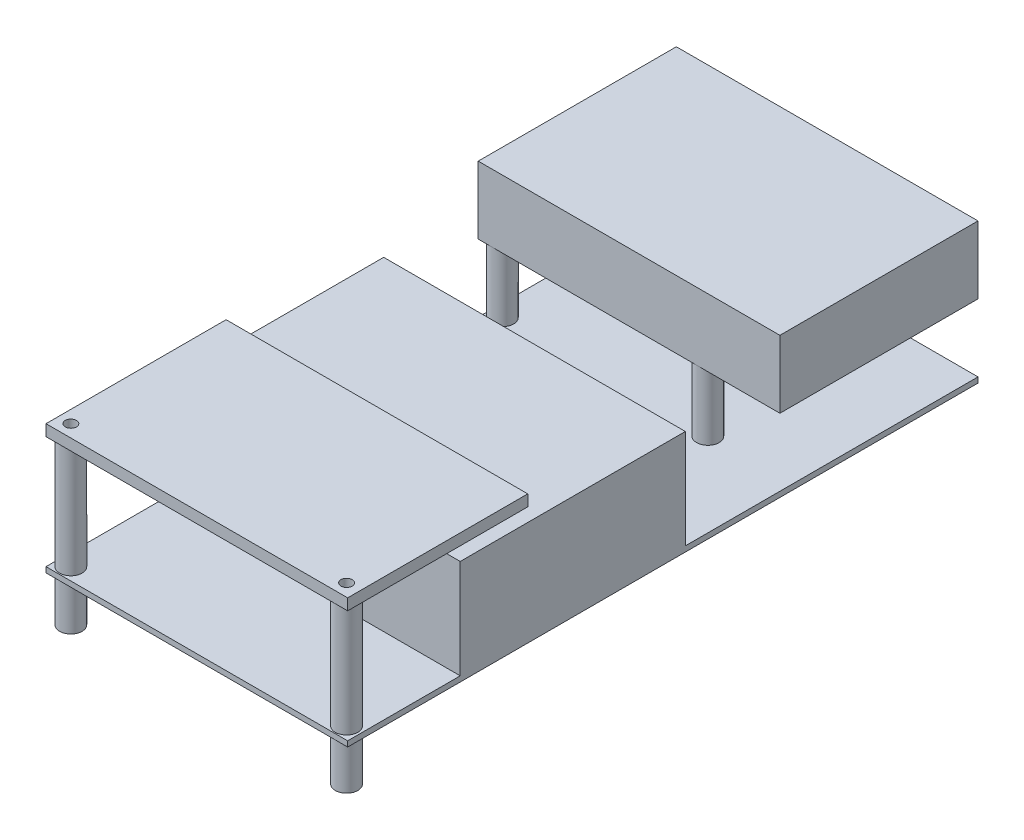
from build123d import *

# Parameters (mm, degrees)
SKETCH1_W           = 85.09
SKETCH1_H           = 177.8
BOSS_EXTRUDE1_DEPTH = 1.524
SKETCH2_R           = 1.5875
CUT_EXTRUDE1_DEPTH  = 198.117910592
SKETCH3_W           = 85.09
SKETCH3_H           = 63.5
BOSS_EXTRUDE2_DEPTH = 27.94
SKETCH4_R           = 3.175
BOSS_EXTRUDE3_DEPTH = 19.05
SKETCH5_W           = 85.09
SKETCH5_H           = 55.88
BOSS_EXTRUDE4_DEPTH = 19.05
BOSS_EXTRUDE5_START = 12.7
SKETCH6_R           = 3.175
BOSS_EXTRUDE5_DEPTH = 12.7
SKETCH7_R           = 3.175
BOSS_EXTRUDE6_DEPTH = 31.75
BOSS_EXTRUDE7_START = 3.175
SKETCH8_W           = 85.09
SKETCH8_H           = 50.8
SKETCH8_R           = 1.5875
BOSS_EXTRUDE7_DEPTH = 3.175


with BuildPart() as part:
    # Sketch1 → Boss-Extrude1 (new body)
    with BuildSketch(Plane(origin=(0, 0, 0), x_dir=(1, 0, 0), z_dir=(0, 1, 0))):
        with Locations((42.545, 88.9)):
            Rectangle(SKETCH1_W, SKETCH1_H)
    extrude(amount=BOSS_EXTRUDE1_DEPTH)

    # Sketch2 → Cut-Extrude1 (cut, through all)
    with BuildSketch(Plane(origin=(0, 1.524, 0), x_dir=(1, 0, 0), z_dir=(0, 1, 0))):
        with Locations((3.5052, 3.5052)):
            Circle(SKETCH2_R)
        with Locations((81.28, 3.5052)):
            Circle(SKETCH2_R)
        with Locations((3.5052, 174.244)):
            Circle(SKETCH2_R)
        with Locations((3.5052, 125.222)):
            Circle(SKETCH2_R)
        with Locations((61.468, 125.222)):
            Circle(SKETCH2_R)
        with Locations((61.468, 174.244)):
            Circle(SKETCH2_R)
    extrude(amount=-CUT_EXTRUDE1_DEPTH, mode=Mode.SUBTRACT)

    # Sketch3 → Boss-Extrude2 (add)
    with BuildSketch(Plane(origin=(0, 1.524, 0), x_dir=(1, 0, 0), z_dir=(0, 1, 0))):
        with Locations((42.545, 63.5)):
            Rectangle(SKETCH3_W, SKETCH3_H)
    extrude(amount=BOSS_EXTRUDE2_DEPTH)

    # Sketch4 → Boss-Extrude3 (add)
    with BuildSketch(Plane(origin=(0, 1.524, 0), x_dir=(1, 0, 0), z_dir=(0, 1, 0))):
        with Locations((3.5052, 174.244)):
            Circle(SKETCH4_R)
        with Locations((61.468, 174.244)):
            Circle(SKETCH4_R)
        with Locations((3.5052, 125.222)):
            Circle(SKETCH4_R)
        with Locations((61.468, 125.222)):
            Circle(SKETCH4_R)
    extrude(amount=BOSS_EXTRUDE3_DEPTH)

    # Sketch5 → Boss-Extrude4 (add)
    with BuildSketch(Plane(origin=(0, 20.574, 0), x_dir=(1, 0, 0), z_dir=(0, 1, 0))):
        with Locations((42.545, 149.86)):
            Rectangle(SKETCH5_W, SKETCH5_H)
    extrude(amount=BOSS_EXTRUDE4_DEPTH)

    # Sketch6 → Boss-Extrude5 (add)
    with BuildSketch(Plane.XZ.offset(BOSS_EXTRUDE5_START)):
        with Locations((3.5052, -3.5052)):
            Circle(SKETCH6_R)
        with Locations((81.28, -3.5052)):
            Circle(SKETCH6_R)
        with Locations((61.468, -125.222)):
            Circle(SKETCH6_R)
        with Locations((3.5052, -125.222)):
            Circle(SKETCH6_R)
        with Locations((3.5052, -174.244)):
            Circle(SKETCH6_R)
        with Locations((61.468, -174.244)):
            Circle(SKETCH6_R)
    extrude(amount=-BOSS_EXTRUDE5_DEPTH)

    # Sketch7 → Boss-Extrude6 (add)
    with BuildSketch(Plane(origin=(0, 1.524, 0), x_dir=(1, 0, 0), z_dir=(0, 1, 0))):
        with Locations((3.5052, 3.5052)):
            Circle(SKETCH7_R)
        with Locations((81.28, 3.5052)):
            Circle(SKETCH7_R)
    extrude(amount=BOSS_EXTRUDE6_DEPTH)

    # Sketch8 → Boss-Extrude7 (add)
    with BuildSketch(Plane(origin=(0, 33.274, 0), x_dir=(1, 0, 0), z_dir=(0, 1, 0)).offset(BOSS_EXTRUDE7_START)):
        with Locations((42.545, 25.4)):
            Rectangle(SKETCH8_W, SKETCH8_H)
        with Locations((81.28, 3.5052)):
            Circle(SKETCH8_R, mode=Mode.SUBTRACT)
        with Locations((3.5052, 3.5052)):
            Circle(SKETCH8_R, mode=Mode.SUBTRACT)
    extrude(amount=-BOSS_EXTRUDE7_DEPTH)


solid = part.part
